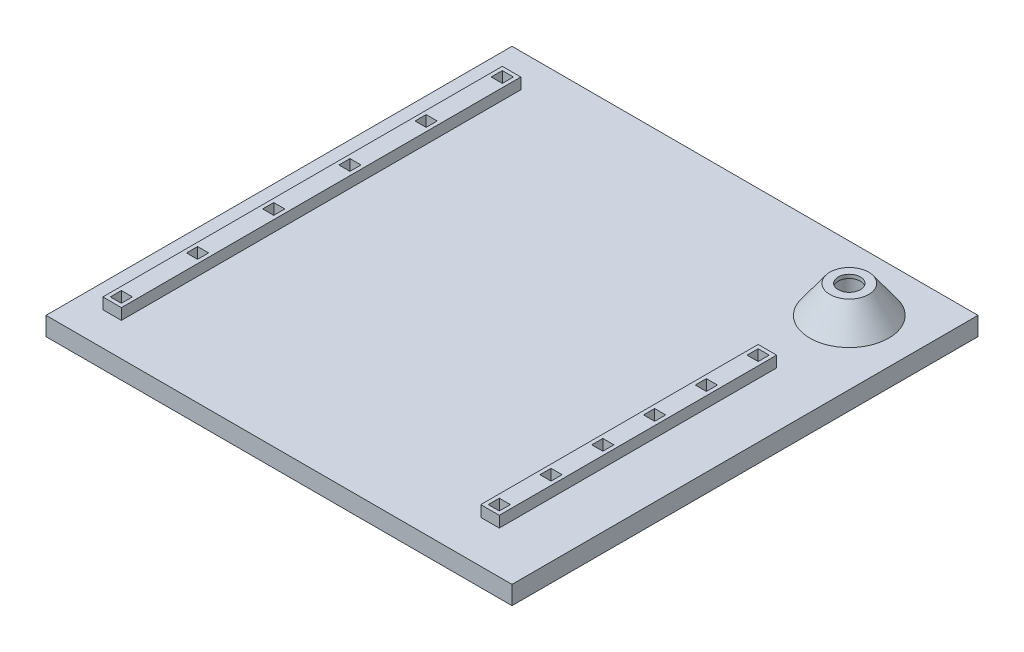
from build123d import *

# Parameters (mm, degrees)
SKETCH1_W           = 126
SKETCH1_H           = 126
BOSS_EXTRUDE1_DEPTH = 5
SKETCH3_R           = 12.5
BOSS_EXTRUDE2_DEPTH = 7.5
SKETCH4_R           = 3.45
CUT_EXTRUDE1_DEPTH  = 11.5
SKETCH6_R           = 3
CUT_EXTRUDE2_DEPTH  = 179.628805068
CHAMFER1_SIZE       = 10
CHAMFER1_SIZE_2     = 7.26542528
SKETCH9_W           = 5
SKETCH9_H           = 75
BOSS_EXTRUDE4_DEPTH = 3
SKETCH10_W          = 3
SKETCH10_H          = 3
CUT_EXTRUDE4_DEPTH  = 179.370401132
SKETCH11_W          = 5
SKETCH11_H          = 108
BOSS_EXTRUDE5_DEPTH = 3
SKETCH12_W          = 3
SKETCH12_H          = 3
CUT_EXTRUDE5_DEPTH  = 179.370401132


with BuildPart() as part:
    # Sketch1 → Boss-Extrude1 (new body)
    with BuildSketch(Plane(origin=(0, 0, 0), x_dir=(1, 0, 0), z_dir=(0, 1, 0))):
        with Locations((63, 63)):
            Rectangle(SKETCH1_W, SKETCH1_H)
    extrude(amount=BOSS_EXTRUDE1_DEPTH)

    # Sketch3 → Boss-Extrude2 (add)
    with BuildSketch(Plane(origin=(0, 5, 0), x_dir=(1, 0, 0), z_dir=(0, 1, 0))):
        with Locations(Location((108.6, 108.6, 0), (0, 0, 90))):
            Circle(SKETCH3_R)
    extrude(amount=BOSS_EXTRUDE2_DEPTH)

    # Sketch4 → Cut-Extrude1 (cut)
    with BuildSketch(Plane.XZ):
        with Locations(Location((108.6, -108.6, 0), (0, 0, 270))):
            Circle(SKETCH4_R)
    extrude(amount=-CUT_EXTRUDE1_DEPTH, mode=Mode.SUBTRACT)

    # Sketch6 → Cut-Extrude2 (cut, through all)
    with BuildSketch(Plane(origin=(0, 12.5, 0), x_dir=(1, 0, 0), z_dir=(0, 1, 0))):
        with Locations(Location((108.6, 108.6, 0), (0, 0, 270))):
            Circle(SKETCH6_R)
    extrude(amount=-CUT_EXTRUDE2_DEPTH, mode=Mode.SUBTRACT)

    # Chamfer1
    # the kernel refuses this chamfer: 10, 7.26542528 mm, written as the material it takes off along each edge
    with BuildSketch(Plane(origin=(108.6, 12.5, -108.6), x_dir=(0, 0, -1), z_dir=(1, 0, 0))) as chamfer1_piece_1_section:
        Polygon((12.5, -CHAMFER1_SIZE), (12.5 - CHAMFER1_SIZE_2, 0), (12.5, 0), align=None)
    chamfer1_piece_1 = revolve(axis=Axis((108.6, 12.5, -108.6), (0, 1, 0)), mode=Mode.PRIVATE)
    chamfer1_piece_1 = split(chamfer1_piece_1, bisect_by=Plane(origin=(108.6, 5, -100.650989912), z_dir=(0, 1, 0)), keep=Keep.TOP, mode=Mode.PRIVATE)
    add(chamfer1_piece_1, mode=Mode.SUBTRACT)

    # Sketch9 → Boss-Extrude4 (add)
    with BuildSketch(Plane(origin=(0, 5, 0), x_dir=(1, 0, 0), z_dir=(0, 1, 0))):
        with Locations((108.6, 48.95817816)):
            Rectangle(SKETCH9_W, SKETCH9_H)
    extrude(amount=BOSS_EXTRUDE4_DEPTH)

    # Sketch10 → Cut-Extrude4 (cut, through all)
    with BuildSketch(Plane(origin=(0, 8, 0), x_dir=(1, 0, 0), z_dir=(0, 1, 0))):
        with Locations((108.6, 83.95817816)):
            Rectangle(SKETCH10_W, SKETCH10_H)
        with Locations((108.6, 69.958932274)):
            Rectangle(SKETCH10_W, SKETCH10_H)
        with Locations((108.6, 55.959686388)):
            Rectangle(SKETCH10_W, SKETCH10_H)
        with Locations((108.6, 41.960440502)):
            Rectangle(SKETCH10_W, SKETCH10_H)
        with Locations((108.6, 27.961194616)):
            Rectangle(SKETCH10_W, SKETCH10_H)
        with Locations((108.6, 13.96194873)):
            Rectangle(SKETCH10_W, SKETCH10_H)
    extrude(amount=-CUT_EXTRUDE4_DEPTH, mode=Mode.SUBTRACT)

    # Sketch11 → Boss-Extrude5 (add)
    with BuildSketch(Plane(origin=(0, 5, 0), x_dir=(1, 0, 0), z_dir=(0, 1, 0))):
        with Locations((8.881061813, 63)):
            Rectangle(SKETCH11_W, SKETCH11_H)
    extrude(amount=BOSS_EXTRUDE5_DEPTH)

    # Sketch12 → Cut-Extrude5 (cut, through all)
    with BuildSketch(Plane(origin=(0, 8, 0), x_dir=(1, 0, 0), z_dir=(0, 1, 0))):
        with Locations((8.881061813, 114.5)):
            Rectangle(SKETCH12_W, SKETCH12_H)
        with Locations((8.881061813, 93.900163021)):
            Rectangle(SKETCH12_W, SKETCH12_H)
        with Locations((8.881061813, 73.300326041)):
            Rectangle(SKETCH12_W, SKETCH12_H)
        with Locations((8.881061813, 52.700489062)):
            Rectangle(SKETCH12_W, SKETCH12_H)
        with Locations((8.881061813, 32.100652082)):
            Rectangle(SKETCH12_W, SKETCH12_H)
        with Locations((8.881061813, 11.500815103)):
            Rectangle(SKETCH12_W, SKETCH12_H)
    extrude(amount=-CUT_EXTRUDE5_DEPTH, mode=Mode.SUBTRACT)


solid = part.part
